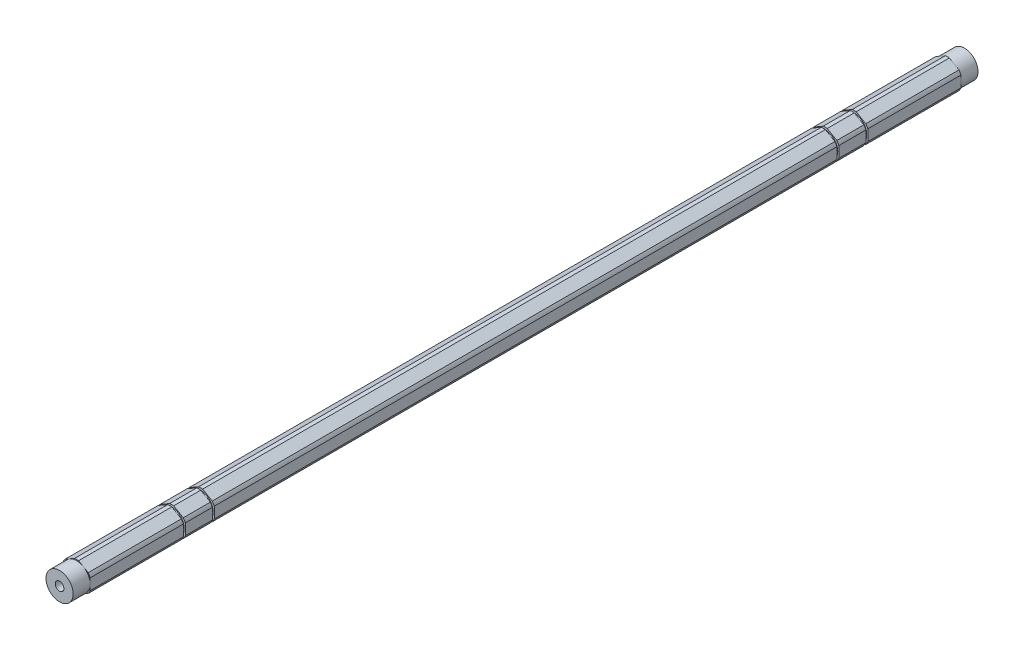
from build123d import *

# Parameters (mm, degrees)
BOSS_EXTRUDE1_DEPTH                  = 203.2
SKETCH6_R                            = 6.35
BOSS_EXTRUDE2_DEPTH                  = 7.9375
F_10_32_TAPPED_HOLE1_D               = 4.0386
F_10_32_TAPPED_HOLE1_DEPTH           = 16.34744
F_10_32_TAPPED_HOLE1_TIP             = 1.213317848
F_10_32_TAPPED_HOLE1_ON_FACE_2_D     = 4.0386
F_10_32_TAPPED_HOLE1_ON_FACE_2_DEPTH = 16.34744
F_10_32_TAPPED_HOLE1_ON_FACE_2_TIP   = 1.213317848
SKETCH5_W                            = 0.889
SKETCH5_H                            = 1.0033


with BuildPart() as part:
    # Sketch1 → Boss-Extrude1 (new, symmetric)
    with BuildSketch(Plane.XY):
        with BuildLine():
            ThreePointArc((0.93173274, 6.79441227), (0, 6.858), (-0.93173274, 6.79441227))
            Line((-0.93173274, 6.79441227), (-5.41826726, 4.204110358))
            ThreePointArc((-5.41826726, 4.204110358), (-5.939202219, 3.429), (-6.35, 2.590301913))
            Line((-6.35, 2.590301913), (-6.35, -2.590301913))
            ThreePointArc((-6.35, -2.590301913), (-5.939202219, -3.429), (-5.41826726, -4.204110358))
            Line((-5.41826726, -4.204110358), (-0.93173274, -6.79441227))
            ThreePointArc((-0.93173274, -6.79441227), (0, -6.858), (0.93173274, -6.79441227))
            Line((0.93173274, -6.79441227), (5.41826726, -4.204110358))
            ThreePointArc((5.41826726, -4.204110358), (5.939202219, -3.429), (6.35, -2.590301913))
            Line((6.35, -2.590301913), (6.35, 2.590301913))
            ThreePointArc((6.35, 2.590301913), (5.939202219, 3.429), (5.41826726, 4.204110358))
            Line((5.41826726, 4.204110358), (0.93173274, 6.79441227))
        make_face()
    extrude(amount=BOSS_EXTRUDE1_DEPTH, both=True)

    # Sketch6 → Boss-Extrude2 (add)
    with BuildSketch(Plane.XY.offset(203.2)):
        Circle(SKETCH6_R)
    boss_extrude2 = extrude(amount=BOSS_EXTRUDE2_DEPTH)

    # Mirror2: Boss-Extrude2 across plane
    add(boss_extrude2.mirror(Plane.XY))

    # #10-32 Tapped Hole1
    with Locations(Plane.XY.offset(211.1375)):
        with Locations((0, 0)):
            Hole(F_10_32_TAPPED_HOLE1_D / 2, depth=F_10_32_TAPPED_HOLE1_DEPTH)
            with Locations((0, 0, -(F_10_32_TAPPED_HOLE1_DEPTH + F_10_32_TAPPED_HOLE1_TIP / 2))):  # 118° drill point
                Cone(0, F_10_32_TAPPED_HOLE1_D / 2, F_10_32_TAPPED_HOLE1_TIP, mode=Mode.SUBTRACT)

    # #10-32 Tapped Hole1 on face 2
    with Locations(Plane(origin=(0, 0, -211.1375), x_dir=(-1, 0, 0), z_dir=(0, 0, -1))):
        with Locations((0, 0)):
            Hole(F_10_32_TAPPED_HOLE1_ON_FACE_2_D / 2, depth=F_10_32_TAPPED_HOLE1_ON_FACE_2_DEPTH)
            with Locations((0, 0, -(F_10_32_TAPPED_HOLE1_ON_FACE_2_DEPTH + F_10_32_TAPPED_HOLE1_ON_FACE_2_TIP / 2))):  # 118° drill point
                Cone(0, F_10_32_TAPPED_HOLE1_ON_FACE_2_D / 2, F_10_32_TAPPED_HOLE1_ON_FACE_2_TIP, mode=Mode.SUBTRACT)

    # Sketch5 → Cut-Revolve1 (revolve, cut)
    with BuildSketch(Plane(origin=(0, 0, 0), x_dir=(0, 0, -1), z_dir=(1, 0, 0))):
        with Locations((-159.26308, 6.35635)):
            Rectangle(SKETCH5_W, SKETCH5_H)
        with Locations((-145.73758, 6.35635)):
            Rectangle(SKETCH5_W, SKETCH5_H)
    cut_revolve1 = revolve(axis=Axis((0, 0, 165.047176272), (0, 0, -1)), mode=Mode.SUBTRACT)

    # Mirror1: Cut-Revolve1 across plane
    add(cut_revolve1.mirror(Plane.XY), mode=Mode.SUBTRACT)


solid = part.part
